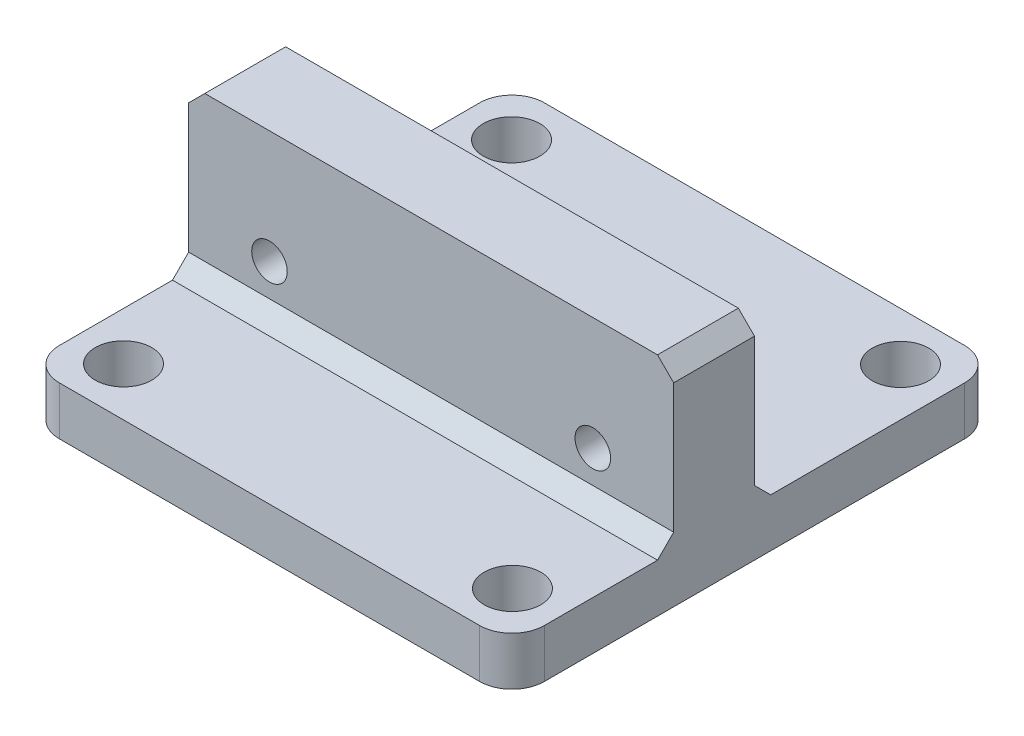
from build123d import *

# Parameters (mm, degrees)
BOSS_EXTRUDE1_DEPTH        = 15
F_3_5_3_5_DIAMETER_HOLE1_D = 3.5
FILLET1_R                  = 2
F_2_2_2_2_DIAMETER_HOLE1_D = 2.2
CHAMFER1_SIZE              = 1
CHAMFER2_SIZE              = 1


with BuildPart() as part:
    # Sketch1 → Boss-Extrude1 (new, symmetric)
    with BuildSketch(Plane(origin=(0, 0, 0), x_dir=(0, 0, -1), z_dir=(1, 0, 0))):
        Polygon((-15, 0), (15, 0), (15, 3), (0, 3), (0, 13), (-5, 13), (-5, 3), (-15, 3), align=None)
    extrude(amount=BOSS_EXTRUDE1_DEPTH, both=True)

    # Ø3.5 (3.5) Diameter Hole1 (through all)
    with Locations(Plane(origin=(0, 3, 0), x_dir=(1, 0, 0), z_dir=(0, 1, 0))):
        with Locations((-12.02948497, 12), (12.02948497, 12), (-12.02948497, -12), (12.02948497, -12)):
            Hole(F_3_5_3_5_DIAMETER_HOLE1_D / 2)

    # Fillet1
    fillet1_edges = [part.edges().sort_by_distance(p)[0] for p in [
        (-15, 1.5, 15),
        (15, 1.5, 15),
        (-15, 1.5, -15),
        (15, 1.5, -15),
    ]]
    fillet(fillet1_edges, radius=FILLET1_R)

    # Ø2.2 (2.2) Diameter Hole1 (through all)
    with Locations(Plane(origin=(0, 0, 0), x_dir=(-1, 0, 0), z_dir=(0, 0, -1))):
        with Locations((-10, 6), (10, 6)):
            Hole(F_2_2_2_2_DIAMETER_HOLE1_D / 2)

    # Chamfer1
    chamfer1_edges = [part.edges().sort_by_distance(p)[0] for p in [
        (0, 3, 0),
        (0, 3, 5),
    ]]
    chamfer(chamfer1_edges, length=CHAMFER1_SIZE)

    # Chamfer2
    chamfer2_edges = [part.edges().sort_by_distance(p)[0] for p in [
        (-15, 13, 2.5),
        (15, 13, 2.5),
    ]]
    chamfer(chamfer2_edges, length=CHAMFER2_SIZE)


solid = part.part
